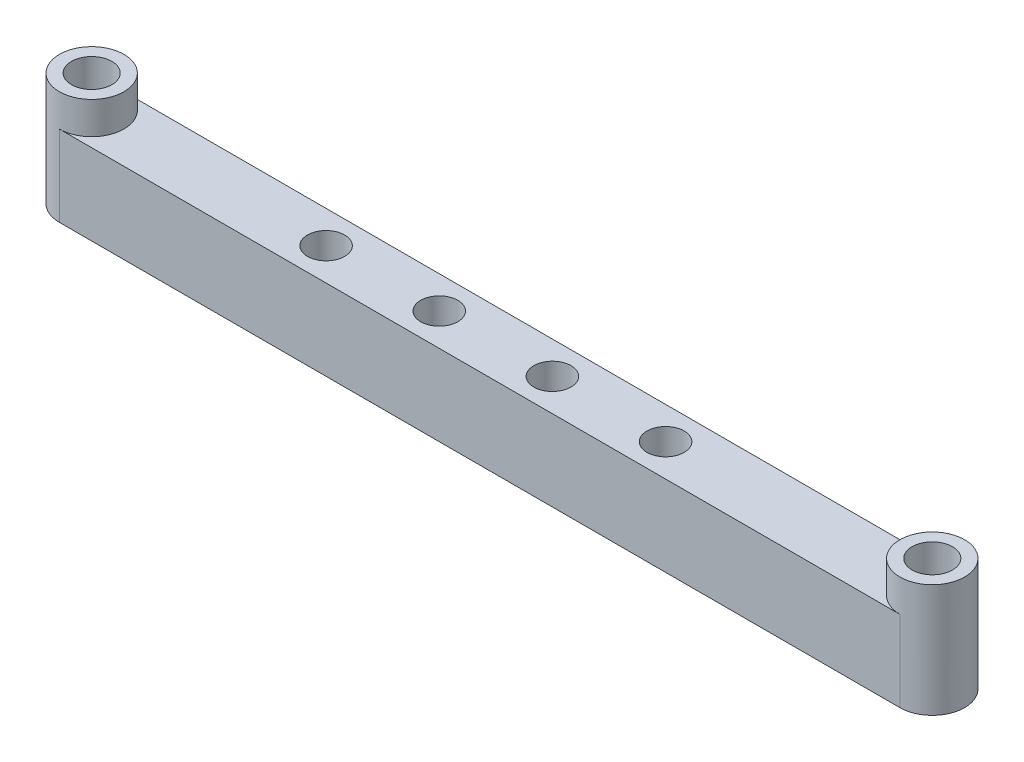
from build123d import *

# Parameters (mm, degrees)
SKETCH1_W           = 56
SKETCH1_H           = 4
SKETCH1_R           = 1.25
SKETCH1_R_2         = 1.15
BOSS_EXTRUDE1_DEPTH = 5
FILLET1_R           = 2
SKETCH2_R           = 2
SKETCH2_R_2         = 1.25
BOSS_EXTRUDE2_DEPTH = 2


with BuildPart() as part:
    # Sketch1 → Boss-Extrude1 (new body)
    with BuildSketch(Plane(origin=(0, 0, 0), x_dir=(1, 0, 0), z_dir=(0, 1, 0))):
        with Locations((28, 2)):
            Rectangle(SKETCH1_W, SKETCH1_H)
        with Locations(Location((2, 2, 0), (0, 0, 270))):
            Circle(SKETCH1_R, mode=Mode.SUBTRACT)
        with Locations(Location((16.5, 2, 0), (0, 0, 270))):
            Circle(SKETCH1_R_2, mode=Mode.SUBTRACT)
        with Locations(Location((23.5, 2, 0), (0, 0, 270))):
            Circle(SKETCH1_R_2, mode=Mode.SUBTRACT)
        with Locations(Location((54, 2, 0), (0, 0, 90))):
            Circle(SKETCH1_R, mode=Mode.SUBTRACT)
        with Locations(Location((30.5, 2, 0), (0, 0, 90))):
            Circle(SKETCH1_R_2, mode=Mode.SUBTRACT)
        with Locations(Location((37.5, 2, 0), (0, 0, 90))):
            Circle(SKETCH1_R_2, mode=Mode.SUBTRACT)
    extrude(amount=BOSS_EXTRUDE1_DEPTH)

    # Fillet1
    fillet1_edges = [part.edges().sort_by_distance(p)[0] for p in [
        (56, 2.5, -4),
        (56, 2.5, 0),
        (0, 2.5, -4),
        (0, 2.5, 0),
    ]]
    fillet(fillet1_edges, radius=FILLET1_R - 0.0001)  # a hair under: the kernel refuses the full size

    # Sketch2 → Boss-Extrude2 (add)
    # profile 1 of 2: a face of its own
    with BuildSketch(Plane(origin=(0, 5, 0), x_dir=(1, 0, 0), z_dir=(0, 1, 0))):
        with Locations(Location((2, 2, 0), (0, 0, 270))):
            Circle(SKETCH2_R)
        with Locations(Location((2, 2, 0), (0, 0, 270))):
            Circle(SKETCH2_R_2, mode=Mode.SUBTRACT)
    # profile 2 of 2: a face of its own
    with BuildSketch(Plane(origin=(0, 5, 0), x_dir=(1, 0, 0), z_dir=(0, 1, 0))):
        with Locations(Location((54, 2, 0), (0, 0, 270))):
            Circle(SKETCH2_R)
        with Locations(Location((54, 2, 0), (0, 0, 90))):
            Circle(SKETCH2_R_2, mode=Mode.SUBTRACT)
    extrude(amount=BOSS_EXTRUDE2_DEPTH)


solid = part.part
